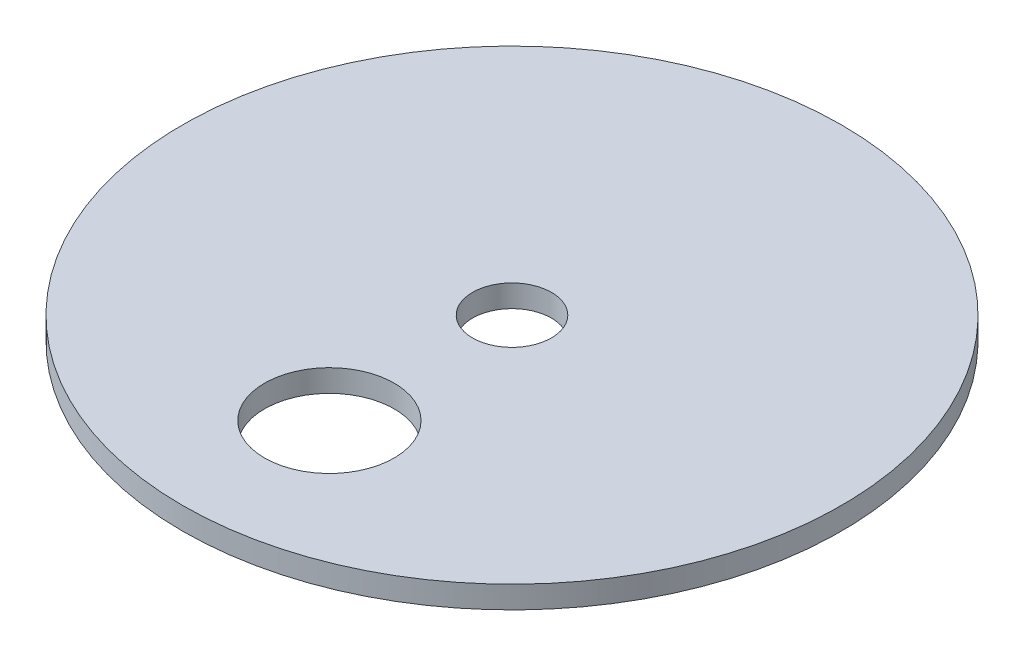
from build123d import *

# Parameters (mm, degrees)
SKETCH1_R               = 44.375
BOSS_EXTRUDE1_DEPTH     = 3
CUT_EXTRUDE2_DEPTH      = 13
CUT_EXTRUDE2_DEPTH_BACK = 3
SKETCH2_R               = 5.315503086
SKETCH2_R_2             = 8.729677968


with BuildPart() as part:
    # Sketch1 → Boss-Extrude1 (new body)
    with BuildSketch(Plane(origin=(0, 0, 0), x_dir=(1, 0, 0), z_dir=(0, 1, 0))):
        Circle(SKETCH1_R)
    extrude(amount=BOSS_EXTRUDE1_DEPTH)

    # Sketch2 → Cut-Extrude2 (cut, two sides: drawn at the far end of the back side and taken through both)
    with BuildSketch(Plane(origin=(0, 0, 0), x_dir=(1, 0, 0), z_dir=(0, 1, 0)).offset(-CUT_EXTRUDE2_DEPTH_BACK)):
        Circle(SKETCH2_R)
        with Locations((0, -24.58879827)):
            Circle(SKETCH2_R_2)
    extrude(amount=CUT_EXTRUDE2_DEPTH + CUT_EXTRUDE2_DEPTH_BACK, mode=Mode.SUBTRACT)


solid = part.part
